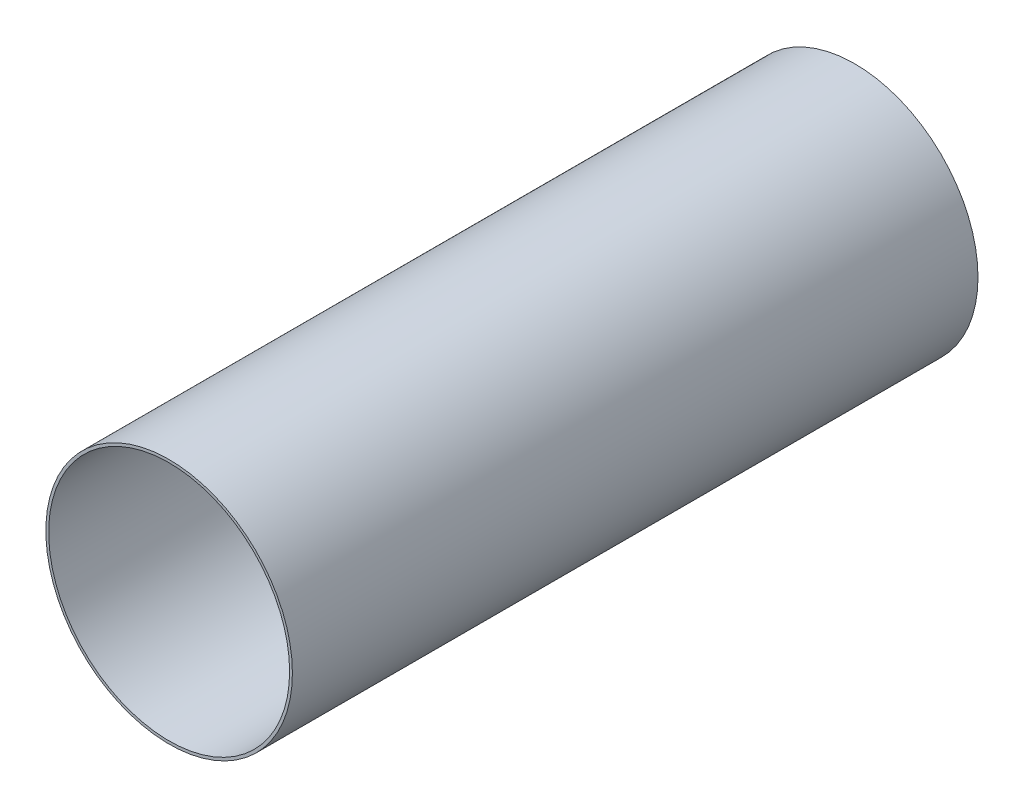
from build123d import *

# Parameters (mm, degrees)
SKETCH1_R           = 49.6697
SKETCH1_R_2         = 48.5394
BOSS_EXTRUDE1_DEPTH = 276.225


with BuildPart() as part:
    # Sketch1 → Boss-Extrude1 (new body)
    with BuildSketch(Plane.XY):
        Circle(SKETCH1_R)
        Circle(SKETCH1_R_2, mode=Mode.SUBTRACT)
    extrude(amount=BOSS_EXTRUDE1_DEPTH)


solid = part.part
